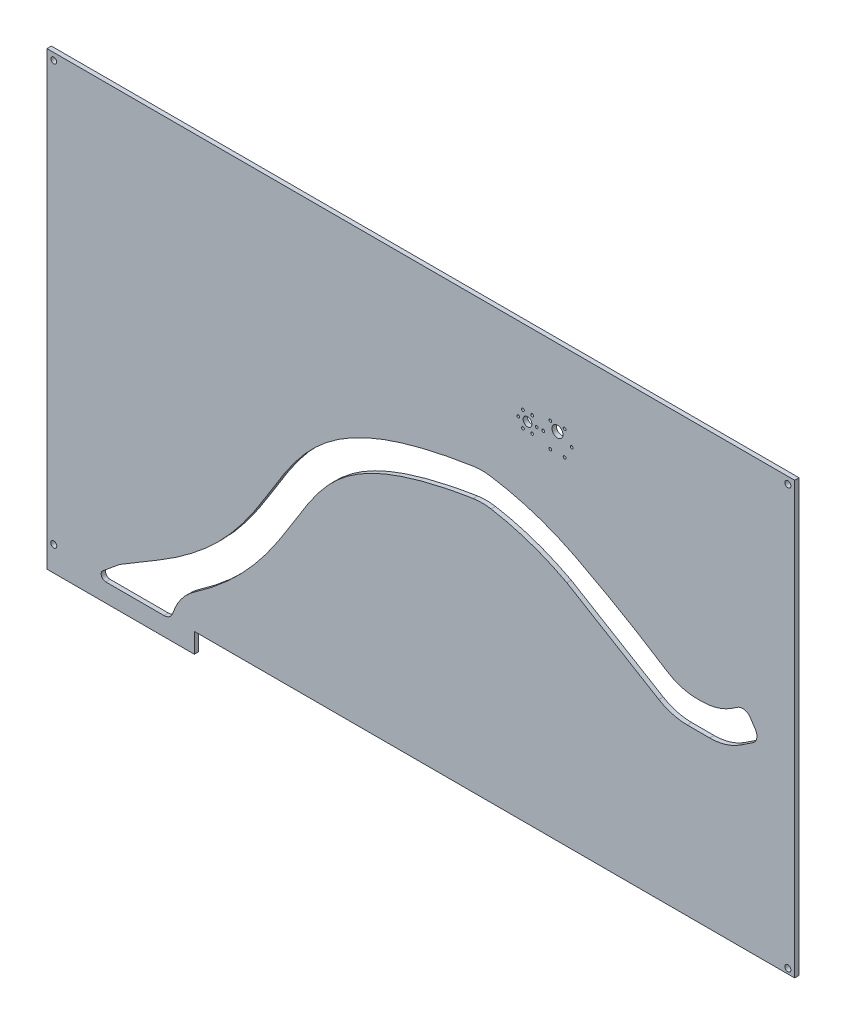
from build123d import *

# Parameters (mm, degrees)
SKETCH1_R           = 3.292374312
SKETCH1_R_2         = 3.294421934
SKETCH1_R_3         = 3.163533699
SKETCH1_R_4         = 1.5
SKETCH1_R_5         = 4.7625
SKETCH1_R_6         = 6
BOSS_EXTRUDE1_DEPTH = 4.7625
FILLET2_R           = 10
FILLET1_R           = 60
FILLET3_R           = 5


with BuildPart() as part:
    # Sketch1 → Boss-Extrude1 (new body)
    with BuildSketch(Plane.XY):
        Polygon((-436.816755826, -147.994392447), (215.080766979, -147.994392447), (215.080766979, 320), (-596.816755826, 320), (-596.816755826, -150), (-596.816755826, -169.55039994), (-436.816755826, -169.55039994), align=None)
        with Locations((-589.375723826, -142.5578)):
            Circle(SKETCH1_R, mode=Mode.SUBTRACT)
        with Locations((207.642212326, -142.5578)):
            Circle(SKETCH1_R, mode=Mode.SUBTRACT)
        with Locations((207.642212326, 312.5578)):
            Circle(SKETCH1_R_2, mode=Mode.SUBTRACT)
        with Locations((-589.375723826, 312.5578)):
            Circle(SKETCH1_R_3, mode=Mode.SUBTRACT)
        with Locations((-85, 230)):
            Circle(SKETCH1_R_4, mode=Mode.SUBTRACT)
        with Locations((-80, 238.660254038)):
            Circle(SKETCH1_R_4, mode=Mode.SUBTRACT)
        with Locations((-70, 238.660254038)):
            Circle(SKETCH1_R_4, mode=Mode.SUBTRACT)
        with Locations((-65, 230)):
            Circle(SKETCH1_R_4, mode=Mode.SUBTRACT)
        with Locations((-70, 221.339745962)):
            Circle(SKETCH1_R_4, mode=Mode.SUBTRACT)
        with Locations((-80, 221.339745962)):
            Circle(SKETCH1_R_4, mode=Mode.SUBTRACT)
        with Locations((-58, 230)):
            Circle(SKETCH1_R_4, mode=Mode.SUBTRACT)
        with Locations((-50.25, 243.423393759)):
            Circle(SKETCH1_R_4, mode=Mode.SUBTRACT)
        with Locations((-34.75, 243.423393759)):
            Circle(SKETCH1_R_4, mode=Mode.SUBTRACT)
        with Locations((-27, 230)):
            Circle(SKETCH1_R_4, mode=Mode.SUBTRACT)
        with Locations((-34.75, 216.576606241)):
            Circle(SKETCH1_R_4, mode=Mode.SUBTRACT)
        with Locations((-50.25, 216.576606241)):
            Circle(SKETCH1_R_4, mode=Mode.SUBTRACT)
        with Locations((-75, 230)):
            Circle(SKETCH1_R_5, mode=Mode.SUBTRACT)
        with Locations((-42.5, 237)):
            Circle(SKETCH1_R_6, mode=Mode.SUBTRACT)
        with BuildLine():
            Line((-475, -100), (-518.031074044, -125.74437106))
            Line((-518.031074044, -125.74437106), (-546.780363752, -149.55039994))
            Line((-546.780363752, -149.55039994), (-459.597813184, -149.55039994))
            Line((-459.597813184, -149.55039994), (-459.597813184, -125.74437106))
            add(Edge.make_bspline(
                [(-459.597813184, -125.74437106), (-458.129207209, -124.865742348), (-455.185829054, -123.081513508), (-449.471359557, -119.524654219), (-442.555549408, -115.046151368), (-434.636214281, -109.639746192), (-424.556425744, -102.386073958), (-412.829398694, -93.24529863), (-400.055778993, -82.1905419), (-388.486450966, -71.092190732), (-374.537420018, -56.304576734), (-359.620141336, -37.979207276), (-344.890774823, -16.767556206), (-332.340078528, 3.245699555), (-321.055163892, 21.796443272), (-310.225956981, 38.664819129), (-299.079604806, 53.834809894), (-286.812791685, 67.514642691), (-272.431751915, 80.088460877), (-257.652665703, 89.924055398), (-243.498210685, 97.442015492), (-231.565093385, 102.886615769), (-218.172694067, 108.112662921), (-203.190999217, 113.087836875), (-189.281720356, 116.996077726), (-177.243425929, 119.962936855), (-167.745823902, 122.104113686), (-157.766000623, 124.157339904), (-149.036898589, 125.791853127), (-141.799270328, 127.051772068), (-136.243143266, 127.972296195), (-131.502167372, 128.719120718), (-127.648712651, 129.303231945), (-125.690331117, 129.592450023), (-124.714693771, 129.734664734)],
                knots=[0, 0, 0, 0, 0.00777259, 0.01554518, 0.03109036, 0.04663554, 0.062180721, 0.093271081, 0.124361441, 0.155451801, 0.186542162, 0.248722882, 0.310903603, 0.373084323, 0.435265044, 0.497445764, 0.559626485, 0.621807206, 0.683987926, 0.746168647, 0.777259007, 0.808349367, 0.839439728, 0.870530088, 0.901620448, 0.917165628, 0.932710808, 0.948255989, 0.963801169, 0.971573759, 0.979346349, 0.987118939, 0.991005234, 0.994891529, 0.994891529, 0.994891529, 0.994891529], degree=3))
            ThreePointArc((-124.714693771, 129.734664734), (-77.172123272, 119.052933104), (-32.323699215, 100))
            Line((-32.323699215, 100), (81.77450832, 31.56416045))
            Line((81.77450832, 31.56416045), (140.88780849, 31.56416045))
            Line((140.88780849, 31.56416045), (177.923308763, 55.973921994))
            Line((177.923308763, 55.973921994), (161.413907899, 81.022668132))
            Line((161.413907899, 81.022668132), (131.890654865, 61.56416045))
            Line((131.890654865, 61.56416045), (90.97120992, 61.56416045))
            ThreePointArc((90.97120992, 61.56416045), (35.57180112, 96.520479224), (-21.701372103, 128.313911667))
            Line((-21.701372103, 128.313911667), (-25, 130))
            ThreePointArc((-25, 130), (-73.684930832, 149.383563894), (-125, 160))
            add(Edge.make_bspline(
                [(-475, -100), (-419.540575809, -66.820070684), (-329.590802121, 43.11603253), (-307.635554762, 134.287094016), (-125, 160)],
                knots=[0, 0, 0, 0, 0.312223899, 1, 1, 1, 1], degree=3))
        make_face(mode=Mode.SUBTRACT)
    extrude(amount=BOSS_EXTRUDE1_DEPTH)

    # Fillet2
    fillet2_edges = [part.edges().sort_by_distance(p)[0] for p in [
        (161.413907899, 81.022668132, 2.38125),
        (177.923308763, 55.973921994, 2.38125),
        (-459.597813184, -149.55039994, 2.38125),
    ]]
    fillet(fillet2_edges, radius=FILLET2_R)

    # Fillet1
    fillet1_edges = [part.edges().sort_by_distance(p)[0] for p in [
        (81.77450832, 31.56416045, 2.38125),
        (140.88780849, 31.56416045, 2.38125),
        (-459.597813184, -125.74437106, 2.38125),
        (-124.714693771, 129.734664734, 2.38125),
        (-125, 160, 2.38125),
        (90.97120992, 61.56416045, 2.38125),
        (131.890654865, 61.56416045, 2.38125),
    ]]
    fillet(fillet1_edges, radius=FILLET1_R)

    # Fillet3
    fillet3_edges = [part.edges().sort_by_distance(p)[0] for p in [
        (-546.780363752, -149.55039994, 2.38125),
    ]]
    fillet(fillet3_edges, radius=FILLET3_R)


solid = part.part
